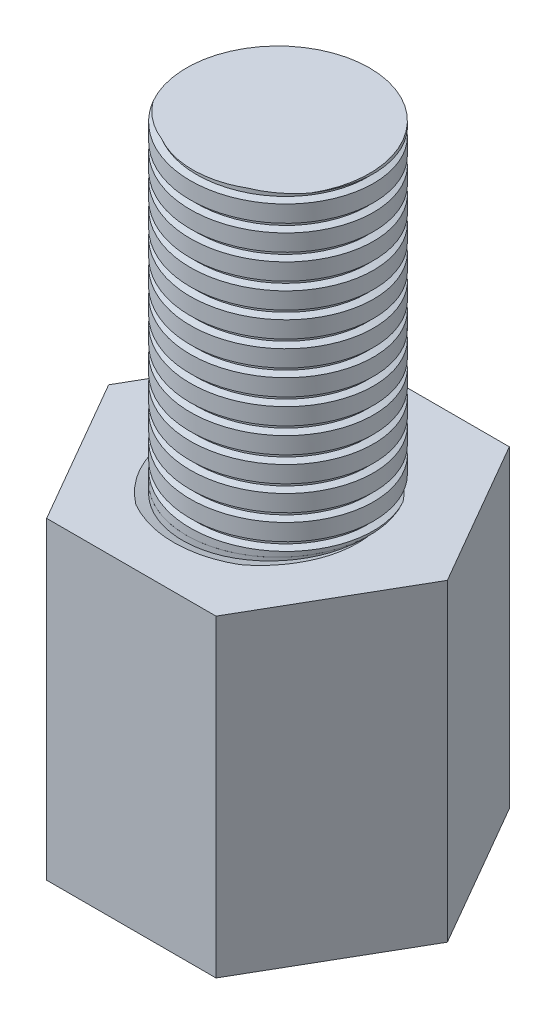
from build123d import *

# Parameters (mm, degrees)
SKETCH_1_R          = 1.46
EXTRUDE_1_DEPTH     = 5
SKETCH_1_3_R        = 1.46
CUT_EXTRUDE_1_DEPTH = 2.5
SKETCH_2_R          = 1.46
EXTRUDE_2_DEPTH     = 5
SWEEP_1_PITCH       = 0.4
SWEEP_1_FROM        = -0.1
SWEEP_2_PITCH       = 0.4


with BuildPart() as part:
    # 草图1 → 凸台-拉伸1 (new body)
    # profile 1 of 2: a face of its own
    with BuildSketch(Plane(origin=(0, 0, 0), x_dir=(1, 0, 0), z_dir=(0, 1, 0))):
        Polygon((-2.70199926, 0), (-1.35099963, -2.34), (1.35099963, -2.34), (2.70199926, 0), (1.35099963, 2.34), (-1.35099963, 2.34), align=None)
        Circle(SKETCH_1_R, mode=Mode.SUBTRACT)
    # profile 2 of 2: a face of its own
    with BuildSketch(Plane(origin=(0, 0, 0), x_dir=(1, 0, 0), z_dir=(0, 1, 0))):
        Circle(SKETCH_1_R)
    extrude(amount=EXTRUDE_1_DEPTH)

    # 草图1<3> → 切除-拉伸1 (cut)
    with BuildSketch(Plane(origin=(0, 0, 0), x_dir=(1, 0, 0), z_dir=(0, 1, 0))):
        with Locations(Location((0, 0, 0), (0, 0, 270))):
            Circle(SKETCH_1_3_R)
    extrude(amount=CUT_EXTRUDE_1_DEPTH, mode=Mode.SUBTRACT)

    # 切除-扫描2: arcs per turn and ends read off the stored shape
    # 切除-扫描2: the profile of 草图7 profile screwed along a right-hand helix through 23.75 turns, 6 arcs to a turn; built about Z, then put on its axis
    sweep_2_z = Axis((0, 0, 0), (0, 0, 1))
    sweep_2_corners = [(1.4597, 0, 0.1001), (1.66, 0, 0.033333333), (1.66, 0, -0.033333333), (1.4597, 0, -0.1001)]
    with BuildLine(mode=Mode.PRIVATE) as sweep_2_profile:
        Line(sweep_2_corners[0], sweep_2_corners[1])
        Line(sweep_2_corners[1], sweep_2_corners[2])
        Line(sweep_2_corners[2], sweep_2_corners[3])
        Line(sweep_2_corners[3], sweep_2_corners[0])
    sweep_2_cap = Face(sweep_2_profile.wire())
    sweep_2_turn_angles = [0, 30, 60, 90, 120, 150, 180, 210, 240, 270, 300, 330, 360]
    sweep_2_turn_weights = [1, 0.8660254037844387, 1, 0.8660254037844387, 1, 0.8660254037844387, 1, 0.8660254037844387, 1, 0.8660254037844387, 1, 0.8660254037844387, 1]
    sweep_2_turn_rails = [Edge.make_bspline([Vector(p[0], p[1], 0).rotate(sweep_2_z, sweep_2_turn_angles[k]) / sweep_2_turn_weights[k] + Vector(0, 0, p[2] + SWEEP_2_PITCH * sweep_2_turn_angles[k] / 360) for k in range(13)], [0, 0, 0, 1, 1, 2, 2, 3, 3, 4, 4, 5, 5, 6, 6, 6], 2, sweep_2_turn_weights) for p in sweep_2_corners]
    sweep_2_turn_sides = [Face.make_surface_from_curves(sweep_2_turn_rails[p[0]], sweep_2_turn_rails[p[1]]) for p in [(0, 1), (1, 2), (2, 3), (3, 0)]]
    sweep_2_last_angles = [8280, 8310, 8340, 8370, 8400, 8430, 8460, 8490, 8520, 8535, 8550]
    sweep_2_last_weights = [1, 0.8660254037844387, 1, 0.8660254037844387, 1, 0.8660254037844387, 1, 0.8660254037844387, 1, 0.965925826289056, 1]
    sweep_2_last_rails = [Edge.make_bspline([Vector(p[0], p[1], 0).rotate(sweep_2_z, sweep_2_last_angles[k]) / sweep_2_last_weights[k] + Vector(0, 0, p[2] + SWEEP_2_PITCH * sweep_2_last_angles[k] / 360) for k in range(11)], [0, 0, 0, 1, 1, 2, 2, 3, 3, 4, 4, 5, 5, 5], 2, sweep_2_last_weights) for p in sweep_2_corners]
    sweep_2_last_sides = [Face.make_surface_from_curves(sweep_2_last_rails[p[0]], sweep_2_last_rails[p[1]]) for p in [(0, 1), (1, 2), (2, 3), (3, 0)]]
    sweep_2 = Plane(origin=(0, 0, 0), x_dir=(0, 0, -1), z_dir=(0, 1, 0)) * Solid(Shell([*[p.moved(Location((0, 0, SWEEP_2_PITCH * i))) for i in range(23) for p in sweep_2_turn_sides], *sweep_2_last_sides, sweep_2_cap, sweep_2_cap.rotate(sweep_2_z, 8550).moved(Location((0, 0, SWEEP_2_PITCH * 8550 / 360)))]))
    add(sweep_2, mode=Mode.SUBTRACT)


with BuildPart() as body_2:
    # 草图2 → 凸台-拉伸2 (new body)
    with BuildSketch(Plane(origin=(0, 5, 0), x_dir=(1, 0, 0), z_dir=(0, 1, 0))):
        with Locations(Location((0, 0, 0), (0, 0, 270))):
            Circle(SKETCH_2_R)
    extrude(amount=EXTRUDE_2_DEPTH)

    # 切除-扫描1: arcs per turn and ends read off the stored shape
    # 切除-扫描1: the profile of 草图4 screwed along a left-hand helix through 18.75 turns, 6 arcs to a turn; built about Z, then put on its axis
    sweep_1_z = Axis((0, 0, 0), (0, 0, 1))
    sweep_1_corners = [(1.56, 5.45e-07, -0.400000022), (1.56, 5.45e-07, -0.200000022), (1.36, 4.75e-07, -0.266666689), (1.36, 4.75e-07, -0.333333356)]
    with BuildLine(mode=Mode.PRIVATE) as sweep_1_profile:
        Line(sweep_1_corners[0], sweep_1_corners[1])
        Line(sweep_1_corners[1], sweep_1_corners[2])
        Line(sweep_1_corners[2], sweep_1_corners[3])
        Line(sweep_1_corners[3], sweep_1_corners[0])
    sweep_1_cap = Face(sweep_1_profile.wire())
    sweep_1_turn_angles = [0, -30, -60, -90, -120, -150, -180, -210, -240, -270, -300, -330, -360]
    sweep_1_turn_weights = [1, 0.8660254037844387, 1, 0.8660254037844387, 1, 0.8660254037844387, 1, 0.8660254037844387, 1, 0.8660254037844387, 1, 0.8660254037844387, 1]
    sweep_1_turn_rails = [Edge.make_bspline([Vector(p[0], p[1], 0).rotate(sweep_1_z, sweep_1_turn_angles[k]) / sweep_1_turn_weights[k] + Vector(0, 0, p[2] + -SWEEP_1_PITCH * sweep_1_turn_angles[k] / 360) for k in range(13)], [0, 0, 0, 1, 1, 2, 2, 3, 3, 4, 4, 5, 5, 6, 6, 6], 2, sweep_1_turn_weights) for p in sweep_1_corners]
    sweep_1_turn_sides = [Face.make_surface_from_curves(sweep_1_turn_rails[p[0]], sweep_1_turn_rails[p[1]]) for p in [(0, 1), (1, 2), (2, 3), (3, 0)]]
    sweep_1_last_angles = [-6480, -6510, -6540, -6570, -6600, -6630, -6660, -6690, -6720, -6735, -6750]
    sweep_1_last_weights = [1, 0.8660254037844387, 1, 0.8660254037844387, 1, 0.8660254037844387, 1, 0.8660254037844387, 1, 0.9659258262889389, 1]
    sweep_1_last_rails = [Edge.make_bspline([Vector(p[0], p[1], 0).rotate(sweep_1_z, sweep_1_last_angles[k]) / sweep_1_last_weights[k] + Vector(0, 0, p[2] + -SWEEP_1_PITCH * sweep_1_last_angles[k] / 360) for k in range(11)], [0, 0, 0, 1, 1, 2, 2, 3, 3, 4, 4, 5, 5, 5], 2, sweep_1_last_weights) for p in sweep_1_corners]
    sweep_1_last_sides = [Face.make_surface_from_curves(sweep_1_last_rails[p[0]], sweep_1_last_rails[p[1]]) for p in [(0, 1), (1, 2), (2, 3), (3, 0)]]
    sweep_1 = Plane(origin=(0, 5.1, 0), x_dir=(0, 0, 1), z_dir=(0, 1, 0)) * split(Solid(Shell([*[p.moved(Location((0, 0, SWEEP_1_PITCH * i))) for i in range(18) for p in sweep_1_turn_sides], *sweep_1_last_sides, sweep_1_cap, sweep_1_cap.rotate(sweep_1_z, -6750).moved(Location((0, 0, -SWEEP_1_PITCH * -6750 / 360)))])), bisect_by=Plane.XY.offset(SWEEP_1_FROM), keep=Keep.TOP, mode=Mode.PRIVATE)
    add(sweep_1, mode=Mode.SUBTRACT)


solid = Compound([part.part, body_2.part])
